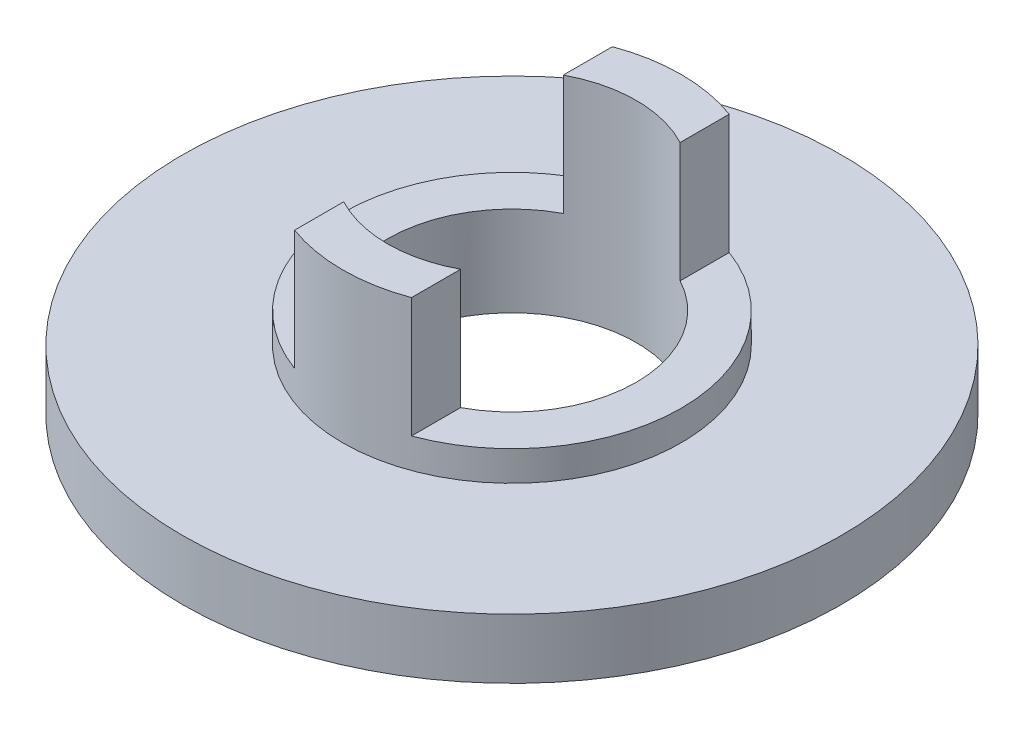
from build123d import *

# Parameters (mm, degrees)
SKETCH_1_R          = 11
SKETCH_1_R_2        = 4.15
EXTRUDE_1_DEPTH     = 2
EXTRUDE_START       = 5
SKETCH_1_3_R        = 5.65
SKETCH_1_3_R_2      = 4.15
EXTRUDE_2_DEPTH     = 5
CUT_EXTRUDE_1_DEPTH = 4


with BuildPart() as part:
    # 草图1 → 凸台-拉伸1 (new body)
    with BuildSketch(Plane(origin=(0, 0, 0), x_dir=(1, 0, 0), z_dir=(0, 1, 0))):
        Circle(SKETCH_1_R)
        Circle(SKETCH_1_R_2, mode=Mode.SUBTRACT)
    extrude(amount=-EXTRUDE_1_DEPTH)

    # 草图1<3> → 凸台-拉伸2 (add)
    with BuildSketch(Plane(origin=(0, 0, 0), x_dir=(1, 0, 0), z_dir=(0, 1, 0)).offset(EXTRUDE_START)):
        Circle(SKETCH_1_3_R)
        Circle(SKETCH_1_3_R_2, mode=Mode.SUBTRACT)
    extrude(amount=-EXTRUDE_2_DEPTH)

    # 草图2 → 切除-拉伸1 (cut)
    with BuildSketch(Plane(origin=(0, 5, 0), x_dir=(1, 0, 0), z_dir=(0, 1, 0))):
        with BuildLine():
            Line((1.95, 5.302829433), (1.95, 3.663331817))
            ThreePointArc((1.95, 3.663331817), (4.15, 0), (1.95, -3.663331817))
            Line((1.95, -3.663331817), (1.95, -5.302829433))
            ThreePointArc((1.95, -5.302829433), (5.65, 0), (1.95, 5.302829433))
        make_face()
        with BuildLine():
            Line((-1.95, 5.302829433), (-1.95, 3.663331817))
            ThreePointArc((-1.95, 3.663331817), (-4.15, 0), (-1.95, -3.663331817))
            Line((-1.95, -3.663331817), (-1.95, -5.302829433))
            ThreePointArc((-1.95, -5.302829433), (-5.65, 0), (-1.95, 5.302829433))
        make_face()
    extrude(amount=-CUT_EXTRUDE_1_DEPTH, mode=Mode.SUBTRACT)


solid = part.part
